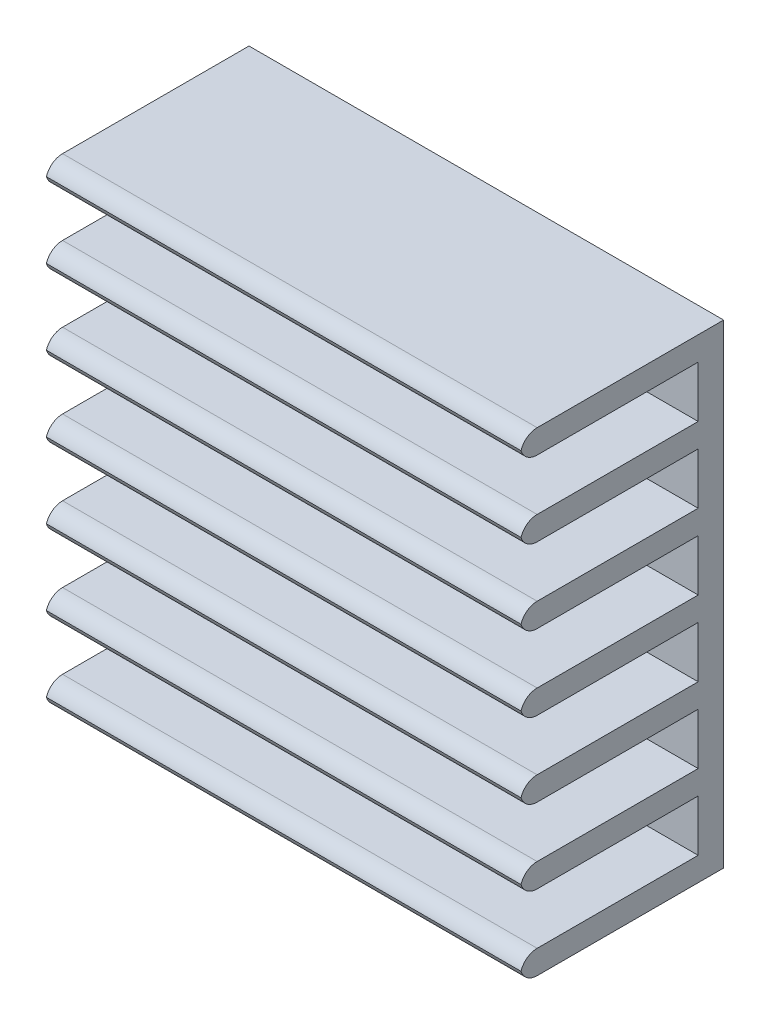
from build123d import *

# Parameters (mm, degrees)
BOSS_EXTRUDE1_DEPTH = 7
FILLET1_R           = 0.5


with BuildPart() as part:
    # Sketch1 → Boss-Extrude1 (new, symmetric)
    with BuildSketch(Plane(origin=(0, 0, 0), x_dir=(0, 0, -1), z_dir=(1, 0, 0))):
        Polygon((-6, 4.783333333), (-6, 4.083333333), (-0.75, 4.083333333), (-0.75, 2.566666667), (-6, 2.566666667), (-6, 1.866666667), (-0.75, 1.866666667), (-0.75, 0.35), (-6, 0.35), (-6, -0.35), (-0.75, -0.35), (-0.75, -1.866666667), (-6, -1.866666667), (-6, -2.566666667), (-0.75, -2.566666667), (-0.75, -4.083333333), (-6, -4.083333333), (-6, -4.783333333), (-0.75, -4.783333333), (-0.75, -6.3), (-6, -6.3), (-6, -7), (0, -7), (0, -6.3), (0, -4.783333333), (0, -4.083333333), (0, -2.566666667), (0, -1.866666667), (0, -0.35), (0, 0.35), (0, 1.866666667), (0, 2.566666667), (0, 4.083333333), (0, 4.783333333), (0, 6.3), (0, 7), (-6, 7), (-6, 6.3), (-0.75, 6.3), (-0.75, 4.783333333), align=None)
    extrude(amount=BOSS_EXTRUDE1_DEPTH, both=True)

    # Fillet1
    # the kernel refuses this fillet: 0.5 mm, written as the material it takes off along each edge
    with BuildSketch(Plane(origin=(-8.25, -7, 6), x_dir=(0, 0, -1), z_dir=(1, 0, 0)), Plane(origin=(-8.25, -6.3, 6), x_dir=(0, -1, 0), z_dir=(1, 0, 0)), Plane(origin=(-8.25, -4.783333333, 6), x_dir=(0, 0, -1), z_dir=(1, 0, 0)), Plane(origin=(-8.25, -4.083333333, 6), x_dir=(0, -1, 0), z_dir=(1, 0, 0)), Plane(origin=(-8.25, -2.566666667, 6), x_dir=(0, 0, -1), z_dir=(1, 0, 0)), Plane(origin=(-8.25, -1.866666667, 6), x_dir=(0, -1, 0), z_dir=(1, 0, 0)), Plane(origin=(-8.25, -0.35, 6), x_dir=(0, 0, -1), z_dir=(1, 0, 0)), Plane(origin=(-8.25, 0.35, 6), x_dir=(0, -1, 0), z_dir=(1, 0, 0)), Plane(origin=(-8.25, 1.866666667, 6), x_dir=(0, 0, -1), z_dir=(1, 0, 0)), Plane(origin=(-8.25, 2.566666667, 6), x_dir=(0, -1, 0), z_dir=(1, 0, 0)), Plane(origin=(-8.25, 6.3, 6), x_dir=(0, 0, -1), z_dir=(1, 0, 0)), Plane(origin=(-8.25, 7, 6), x_dir=(0, -1, 0), z_dir=(1, 0, 0))) as fillet1_piece_1:
        with BuildLine():
            CenterArc((FILLET1_R, FILLET1_R), FILLET1_R, 180, 90)
            Line((0, FILLET1_R), (0, 0))
            Line((0, 0), (FILLET1_R, 0))
        make_face()
    extrude(amount=16.5, mode=Mode.SUBTRACT)
    with BuildSketch(Plane(origin=(-8.25, 4.083333333, 6), x_dir=(0, 1, 0), z_dir=(1, 0, 0)), Plane(origin=(8.25, 4.783333333, 6), x_dir=(0, -1, 0), z_dir=(-1, 0, 0))) as fillet1_piece_2:
        with BuildLine():
            CenterArc((FILLET1_R, -FILLET1_R), FILLET1_R, 90, 90)
            Line((0, -FILLET1_R), (0, 0))
            Line((0, 0), (FILLET1_R, 0))
        make_face()
    extrude(amount=16.5, mode=Mode.SUBTRACT)


solid = part.part
